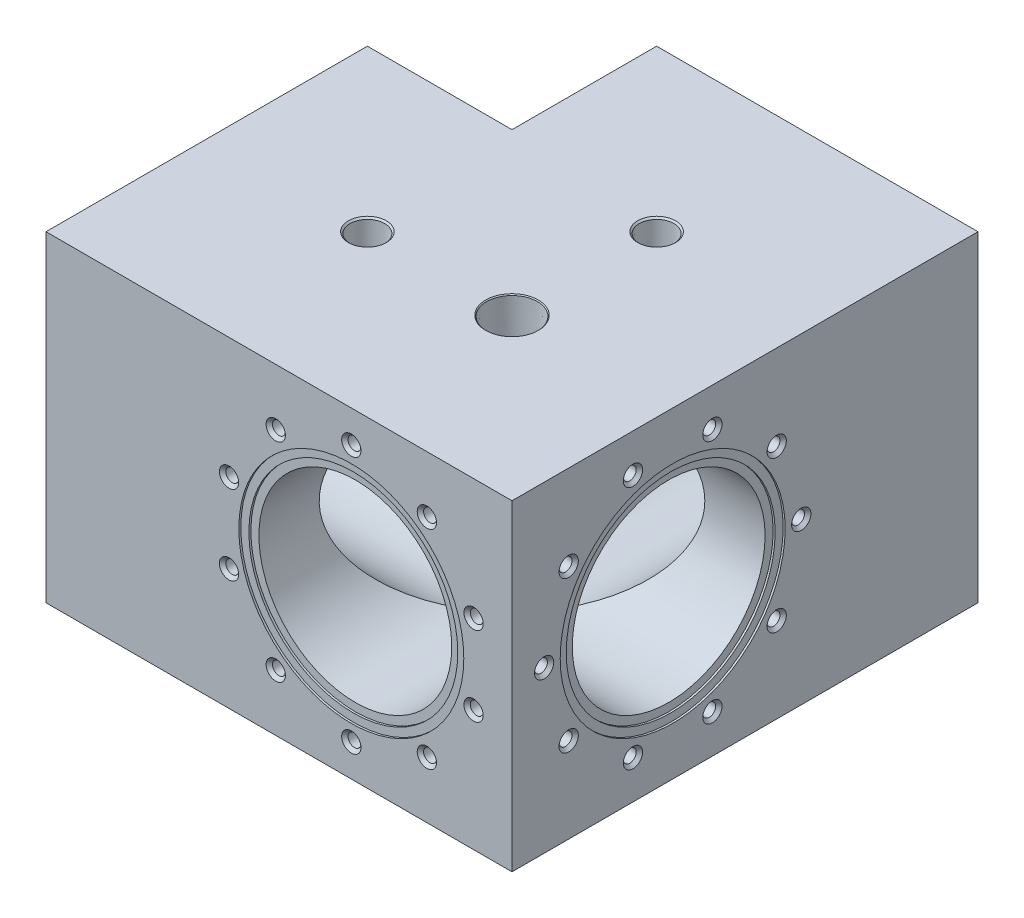
from build123d import *

# Parameters (mm, degrees)
SKETCH1_W                         = 184.15
SKETCH1_H                         = 184.15
CUBE_DEPTH                        = 127
SKETCH2_R                         = 38.1
Z_BORE_DEPTH                      = 165.1
SKETCH4_R                         = 38.1
X_BORE_DEPTH                      = 165.1
SKETCH10_W                        = 57.15
SKETCH10_H                        = 57.15
EXCESS_CUT_DEPTH                  = 182.89175696
SKETCH45_R                        = 44.45
BORE_FOR_GASKET_MOUNT1_DEPTH      = 0.79375
SKETCH46_R                        = 44.45
BORE_FOR_GASKET_MOUNT2_DEPTH      = 0.79375
F_1_4_20_TAPPED_HOLE1_D           = 5.1054
F_1_4_20_TAPPED_HOLE1_DEPTH       = 19.05
F_1_4_20_TAPPED_HOLE1_CSINK_D     = 7.62
F_1_4_20_TAPPED_HOLE1_CSINK_ANGLE = 90
F_1_4_20_TAPPED_HOLE1_TIP         = 1.533816902
F_1_4_20_TAPPED_HOLE2_D           = 5.1054
F_1_4_20_TAPPED_HOLE2_DEPTH       = 19.05
F_1_4_20_TAPPED_HOLE2_CSINK_D     = 7.62
F_1_4_20_TAPPED_HOLE2_CSINK_ANGLE = 90
F_1_4_20_TAPPED_HOLE2_TIP         = 1.533816902
F_1_4_NPT_TAPPED_HOLE1_AT_2_COUNT = 2
F_1_4_NPT_TAPPED_HOLE1_AT_2_PITCH = 80.82230509
SKETCH61_R                        = 41.275
CUT_EXTRUDE1_DEPTH                = 0.79375
SKETCH62_R                        = 41.275
CUT_EXTRUDE2_DEPTH                = 0.79375


# Read off the part's stored shape, not the designer's step: 1 NPT Tapped Hole2, 1 NPT Tapped Hole3
with BuildPart() as part:
    # Sketch1 → Cube (new body)
    with BuildSketch(Plane(origin=(0, 0, 0), x_dir=(1, 0, 0), z_dir=(0, 1, 0))):
        Rectangle(SKETCH1_W, SKETCH1_H)
    extrude(amount=CUBE_DEPTH)

    # Sketch2 → Z Bore (cut)
    with BuildSketch(Plane.XY.offset(92.075)):
        with Locations((28.575, 63.5)):
            Circle(SKETCH2_R)
    extrude(amount=-Z_BORE_DEPTH, mode=Mode.SUBTRACT)

    # Sketch4 → X Bore (cut)
    with BuildSketch(Plane(origin=(92.075, 0, 0), x_dir=(0, 0, -1), z_dir=(1, 0, 0))):
        with Locations((-28.575, 63.5)):
            Circle(SKETCH4_R)
    extrude(amount=-X_BORE_DEPTH, mode=Mode.SUBTRACT)

    # Sketch10 → Excess Cut (cut, through all)
    with BuildSketch(Plane(origin=(0, 127, 0), x_dir=(1, 0, 0), z_dir=(0, 1, 0))):
        with Locations((-63.5, 63.5)):
            Rectangle(SKETCH10_W, SKETCH10_H)
    extrude(amount=-EXCESS_CUT_DEPTH, mode=Mode.SUBTRACT)

    # Sketch21 → 1/2 NPT Tapped Hole1 (revolve, cut)
    with BuildSketch(Plane(origin=(28.575, 127, 28.575), x_dir=(0, 0, 1), z_dir=(1, 0, 0))):
        Polygon((0, 0), (0, 33.558543693), (8.9281, 28.194), (8.9281, 19.05), (9.490619836, 19.05), (10.0501069, 0.3638931), (10.414, 0), align=None)
    revolve(axis=Axis((28.575, 133.35, 28.575), (0, -1, 0)), mode=Mode.SUBTRACT)

    # Sketch23 → 1/2 NPT Tapped Hole2 (revolve, cut)
    with BuildSketch(Plane(origin=(28.575, 0, 28.575), x_dir=(0, 0, -1), z_dir=(1, 0, 0))):
        Polygon((0, 0), (0, 33.558543693), (8.9281, 28.194), (8.9281, 19.05), (9.490619836, 19.05), (10.0501069, 0.3638931), (10.414, 0), align=None)
    revolve(axis=Axis((28.575, -6.35, 28.575), (0, 1, 0)), mode=Mode.SUBTRACT)

    # 1 NPT Tapped Hole2 outline → 1 NPT Tapped Hole2 (revolve, cut)
    with BuildSketch(Plane(origin=(0, 63.5, 28.575), x_dir=(0, 1, 0), z_dir=(0, 0, -1))):
        Polygon((0, -92.075), (17.403318, -92.075), (16.7682672, -91.4399492), (16.21689896, -73.025), (0, -73.025), align=None)
    revolve(axis=Axis((0, 63.5, 28.575), (1, 0, 0)), mode=Mode.SUBTRACT)

    # 1 NPT Tapped Hole3 outline → 1 NPT Tapped Hole3 (revolve, cut)
    with BuildSketch(Plane(origin=(28.575, 63.5, 0), x_dir=(1, 0, 0), z_dir=(0, -1, 0))):
        Polygon((0, -92.075), (17.403318, -92.075), (16.7682672, -91.4399492), (16.21689896, -73.025), (0, -73.025), align=None)
    revolve(axis=Axis((28.575, 63.5, 0), (0, 0, 1)), mode=Mode.SUBTRACT)

    # Sketch45 → Bore for Gasket Mount1 (cut)
    with BuildSketch(Plane.XY.offset(92.075)):
        with Locations((28.575, 63.5)):
            Circle(SKETCH45_R)
    extrude(amount=-BORE_FOR_GASKET_MOUNT1_DEPTH, mode=Mode.SUBTRACT)

    # Sketch46 → Bore for Gasket Mount2 (cut)
    with BuildSketch(Plane(origin=(92.075, 0, 0), x_dir=(0, 0, -1), z_dir=(1, 0, 0))):
        with Locations((-28.575, 63.5)):
            Circle(SKETCH46_R)
    extrude(amount=-BORE_FOR_GASKET_MOUNT2_DEPTH, mode=Mode.SUBTRACT)

    # 1/4-20 Tapped Hole1
    with Locations(Plane.XY.offset(92.075)):
        with Locations((28.575, 114.3), (58.434490816, 104.598063314), (76.888671028, 79.198063314), (76.888671028, 47.801936686), (58.434490816, 22.401936686), (28.575, 12.7), (-1.284490816, 22.401936686), (-19.738671028, 47.801936686), (-19.738671028, 79.198063314), (-1.284490816, 104.598063314)):
            CounterSinkHole(F_1_4_20_TAPPED_HOLE1_D / 2, F_1_4_20_TAPPED_HOLE1_CSINK_D / 2, depth=F_1_4_20_TAPPED_HOLE1_DEPTH, counter_sink_angle=F_1_4_20_TAPPED_HOLE1_CSINK_ANGLE)
            with Locations((0, 0, -(F_1_4_20_TAPPED_HOLE1_DEPTH + F_1_4_20_TAPPED_HOLE1_TIP / 2))):  # 118° drill point
                Cone(0, F_1_4_20_TAPPED_HOLE1_D / 2, F_1_4_20_TAPPED_HOLE1_TIP, mode=Mode.SUBTRACT)

    # 1/4-20 Tapped Hole2
    with Locations(Plane(origin=(92.075, 0, 0), x_dir=(0, 0, -1), z_dir=(1, 0, 0))):
        with Locations((-44.273063314, 111.813671028), (-12.876936686, 111.813671028), (12.523063314, 93.359490816), (22.225, 63.5), (12.523063314, 33.640509184), (-12.876936686, 15.186328972), (-44.273063314, 15.186328972), (-69.673063314, 33.640509184), (-79.375, 63.5), (-69.673063314, 93.359490816)):
            CounterSinkHole(F_1_4_20_TAPPED_HOLE2_D / 2, F_1_4_20_TAPPED_HOLE2_CSINK_D / 2, depth=F_1_4_20_TAPPED_HOLE2_DEPTH, counter_sink_angle=F_1_4_20_TAPPED_HOLE2_CSINK_ANGLE)
            with Locations((0, 0, -(F_1_4_20_TAPPED_HOLE2_DEPTH + F_1_4_20_TAPPED_HOLE2_TIP / 2))):  # 118° drill point
                Cone(0, F_1_4_20_TAPPED_HOLE2_D / 2, F_1_4_20_TAPPED_HOLE2_TIP, mode=Mode.SUBTRACT)

    # Sketch54 → 1/4 NPT Tapped Hole1 (revolve, cut)
    with BuildSketch(Plane(origin=(-28.575, 127, 28.575), x_dir=(0, 0, 1), z_dir=(1, 0, 0))):
        Polygon((0, 0), (0, 20.360347279), (5.5626, 17.018), (5.5626, 9.906), (6.576997545, 9.906), (6.8545837, 0.635), (7.4895837, 0), align=None)
    f_1_4_npt_tapped_hole1 = revolve(axis=Axis((-28.575, 133.35, 28.575), (0, -1, 0)), mode=Mode.SUBTRACT)

    # 1/4 NPT Tapped Hole1 at 2: 1/4 NPT Tapped Hole1 ×2
    with Locations(*[Vector(0.7071067811865474, 0, -0.7071067811865478) * (i * F_1_4_NPT_TAPPED_HOLE1_AT_2_PITCH) for i in range(1, F_1_4_NPT_TAPPED_HOLE1_AT_2_COUNT)]):
        add(f_1_4_npt_tapped_hole1, mode=Mode.SUBTRACT)

    # Sketch61 → Cut-Extrude1 (cut)
    with BuildSketch(Plane.XY.offset(91.28125)):
        with Locations((28.575, 63.5)):
            Circle(SKETCH61_R)
    extrude(amount=-CUT_EXTRUDE1_DEPTH, mode=Mode.SUBTRACT)

    # Sketch62 → Cut-Extrude2 (cut)
    with BuildSketch(Plane(origin=(91.28125, 0, 0), x_dir=(0, 0, -1), z_dir=(1, 0, 0))):
        with Locations((-28.575, 63.5)):
            Circle(SKETCH62_R)
    extrude(amount=-CUT_EXTRUDE2_DEPTH, mode=Mode.SUBTRACT)


solid = part.part
